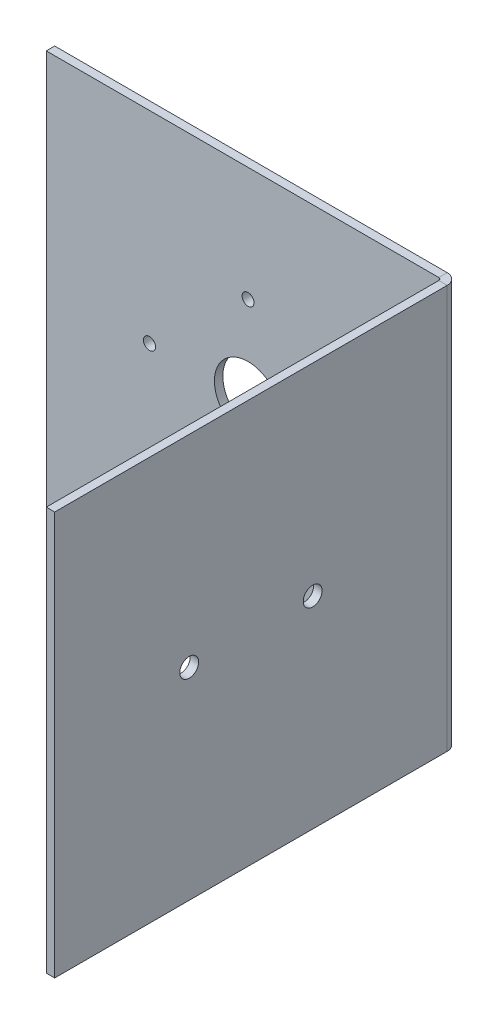
from build123d import *

# Parameters (mm, degrees)
BASE_FLANGE1_DEPTH = 76.2
SKETCH6_R          = 12.7
CUT_EXTRUDE1_DEPTH = 227.495696703
SKETCH7_R          = 2.2606
CUT_EXTRUDE2_DEPTH = 227.495696703
SKETCH9_R          = 2.286
CUT_EXTRUDE3_DEPTH = 227.495696703
SKETCH10_R         = 3.556
CUT_EXTRUDE4_DEPTH = 229.6


# Sheet-metal steps are written as plain solids
with BuildPart() as part:
    # Sketch1 → Base-Flange1 (new, symmetric)
    with BuildSketch(Plane(origin=(0, 0, 0), x_dir=(1, 0, 0), z_dir=(0, 1, 0))):
        with BuildLine():
            Line((-152.4, 0), (-4.175, 0))
            ThreePointArc((-4.175, 0), (-1.222829189, -1.222829189), (0, -4.175))
            Line((0, -4.175), (0, -152.4))
            Line((0, -152.4), (-3.175, -152.4))
            Line((-3.175, -152.4), (-3.175, -4.175))
            ThreePointArc((-3.175, -4.175), (-3.467893219, -3.467893219), (-4.175, -3.175))
            Line((-4.175, -3.175), (-152.4, -3.175))
            Line((-152.4, -3.175), (-152.4, 0))
        make_face()
    extrude(amount=BASE_FLANGE1_DEPTH, both=True)

    # Sketch6 → Cut-Extrude1 (cut, through all)
    with BuildSketch(Plane.XY.offset(3.175)):
        with Locations((-76.2, 0)):
            Circle(SKETCH6_R)
    extrude(amount=-CUT_EXTRUDE1_DEPTH, mode=Mode.SUBTRACT)

    # Sketch7 → Cut-Extrude2 (cut, through all)
    with BuildSketch(Plane.XY.offset(3.175)):
        with Locations((-76.2, 33.02)):
            Circle(SKETCH7_R)
        with Locations(Location((-76.2, -33.02, 0), (0, 0, 180))):
            Circle(SKETCH7_R)
    extrude(amount=-CUT_EXTRUDE2_DEPTH, mode=Mode.SUBTRACT)

    # Sketch9 → Cut-Extrude3 (cut, through all)
    with BuildSketch(Plane.XY.offset(3.175)):
        with Locations((-113.42361984, 0)):
            Circle(SKETCH9_R)
    extrude(amount=-CUT_EXTRUDE3_DEPTH, mode=Mode.SUBTRACT)

    # Sketch10 → Cut-Extrude4 (cut, through all)
    with BuildSketch(Plane(origin=(0, 0, 0), x_dir=(0, 0, -1), z_dir=(1, 0, 0))):
        with Locations((-54.975, 0)):
            Circle(SKETCH10_R)
        with Locations((-101.6, 0)):
            Circle(SKETCH10_R)
    extrude(amount=-CUT_EXTRUDE4_DEPTH, mode=Mode.SUBTRACT)


solid = part.part
